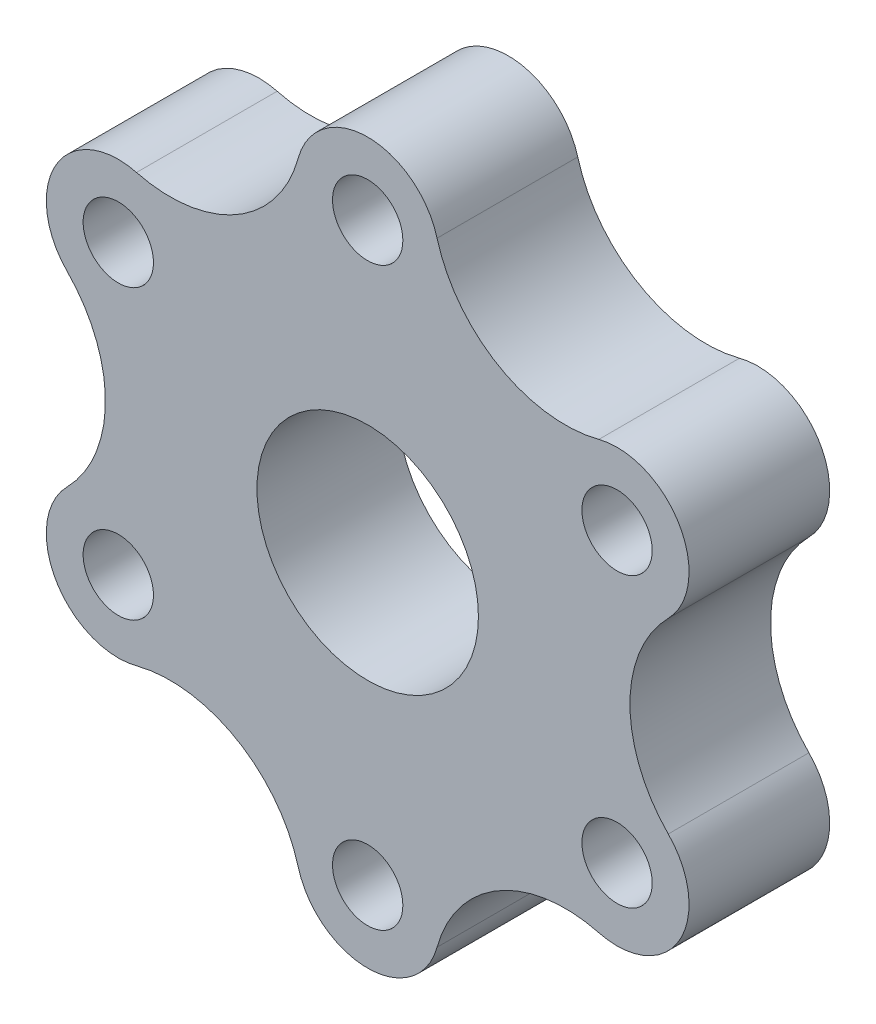
from build123d import *

# Parameters (mm, degrees)
SKETCH1_R           = 10
SKETCH1_R_2         = 3.175
BOSS_EXTRUDE1_DEPTH = 6.35


with BuildPart() as part:
    # Sketch1 → Boss-Extrude1 (new, symmetric)
    with BuildSketch(Plane.XY):
        with BuildLine():
            ThreePointArc((6.267951244, 27.721274878), (0, 32.5), (-6.267951244, 27.721274878))
            ThreePointArc((-6.267951244, 27.721274878), (-11.83955354, 20.50670827), (-20.873352648, 19.288842446))
            ThreePointArc((-20.873352648, 19.288842446), (-28.145825623, 16.25), (-27.141303892, 8.432432432))
            ThreePointArc((-27.141303892, 8.432432432), (-23.679107079, 0), (-27.141303892, -8.432432432))
            ThreePointArc((-27.141303892, -8.432432432), (-28.145825623, -16.25), (-20.873352648, -19.288842446))
            ThreePointArc((-20.873352648, -19.288842446), (-11.83955354, -20.50670827), (-6.267951244, -27.721274878))
            ThreePointArc((-6.267951244, -27.721274878), (0, -32.5), (6.267951244, -27.721274878))
            ThreePointArc((6.267951244, -27.721274878), (11.83955354, -20.50670827), (20.873352648, -19.288842446))
            ThreePointArc((20.873352648, -19.288842446), (28.145825623, -16.25), (27.141303892, -8.432432432))
            ThreePointArc((27.141303892, -8.432432432), (23.679107079, 0), (27.141303892, 8.432432432))
            ThreePointArc((27.141303892, 8.432432432), (28.145825623, 16.25), (20.873352648, 19.288842446))
            ThreePointArc((20.873352648, 19.288842446), (11.83955354, 20.50670827), (6.267951244, 27.721274878))
        make_face()
        Circle(SKETCH1_R, mode=Mode.SUBTRACT)
        with Locations((0, 26)):
            Circle(SKETCH1_R_2, mode=Mode.SUBTRACT)
        with Locations((22.516660498, 13)):
            Circle(SKETCH1_R_2, mode=Mode.SUBTRACT)
        with Locations((22.516660498, -13)):
            Circle(SKETCH1_R_2, mode=Mode.SUBTRACT)
        with Locations((0, -26)):
            Circle(SKETCH1_R_2, mode=Mode.SUBTRACT)
        with Locations((-22.516660498, -13)):
            Circle(SKETCH1_R_2, mode=Mode.SUBTRACT)
        with Locations((-22.516660498, 13)):
            Circle(SKETCH1_R_2, mode=Mode.SUBTRACT)
    extrude(amount=BOSS_EXTRUDE1_DEPTH, both=True)


solid = part.part
